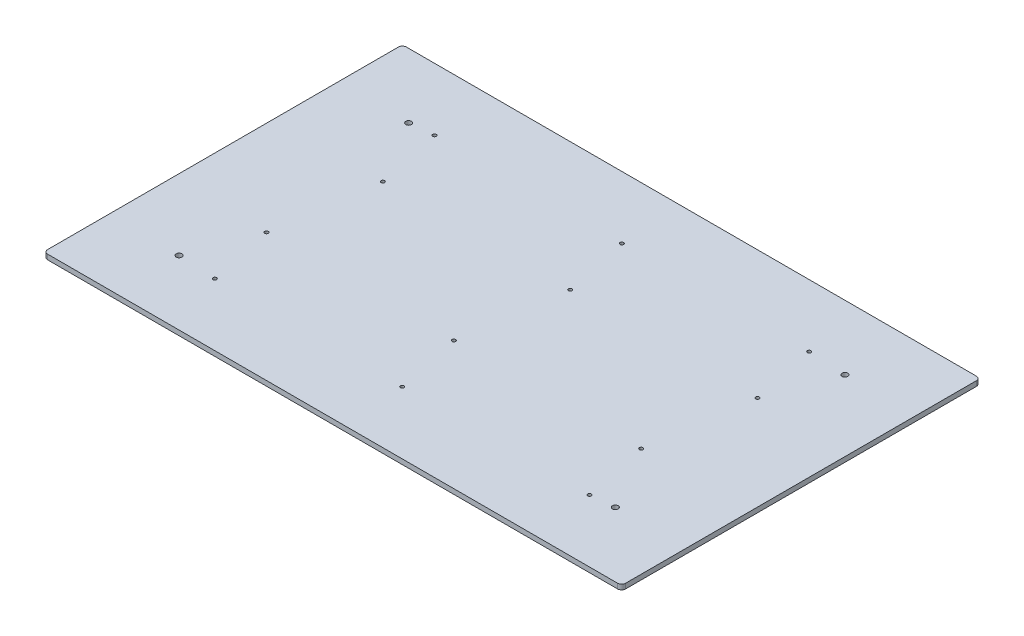
from build123d import *

# Parameters (mm, degrees)
SKETCH1_W                 = 368.3
SKETCH1_H                 = 228.6
BOSS_EXTRUDE1_DEPTH       = 3.175
F_6_CLEARANCE_HOLE1_D     = 3.6576
TAP_DRILL_FOR_4_40_TAP1_D = 2.2606
FILLET1_R                 = 2.54


with BuildPart() as part:
    # Sketch1 → Boss-Extrude1 (new body)
    with BuildSketch(Plane(origin=(0, 0, 0), x_dir=(1, 0, 0), z_dir=(0, 1, 0))):
        Rectangle(SKETCH1_W, SKETCH1_H)
    extrude(amount=BOSS_EXTRUDE1_DEPTH)

    # #6 Clearance Hole1 (through all)
    with Locations(Plane(origin=(0, 0, 0), x_dir=(-1, 0, 0), z_dir=(0, -1, 0))):
        with Locations((-139.0015, 73.152), (139.0015, 73.152), (139.0015, -73.152), (-139.0015, -73.152)):
            Hole(F_6_CLEARANCE_HOLE1_D / 2)

    # Tap Drill for #4-40 Tap1 (through all)
    with Locations(Plane(origin=(0, 0, 0), x_dir=(-1, 0, 0), z_dir=(0, -1, 0))):
        with Locations((-114.847391596, 74.54728998), (-123.912608404, 32.51371002), (4.532608404, 74.54728998), (-4.532608404, 32.51371002), (123.912608404, 74.54728998), (114.847391596, 32.51371002), (123.912608404, -32.51371002), (114.847391596, -74.54728998), (4.532608404, -32.51371002), (-4.532608404, -74.54728998), (-114.847391596, -32.51371002), (-123.912608404, -74.54728998)):
            Hole(TAP_DRILL_FOR_4_40_TAP1_D / 2)

    # Fillet1
    fillet1_edges = [part.edges().sort_by_distance(p)[0] for p in [
        (184.15, 1.5875, -114.3),
        (-184.15, 1.5875, -114.3),
        (-184.15, 1.5875, 114.3),
        (184.15, 1.5875, 114.3),
    ]]
    fillet(fillet1_edges, radius=FILLET1_R)


solid = part.part
